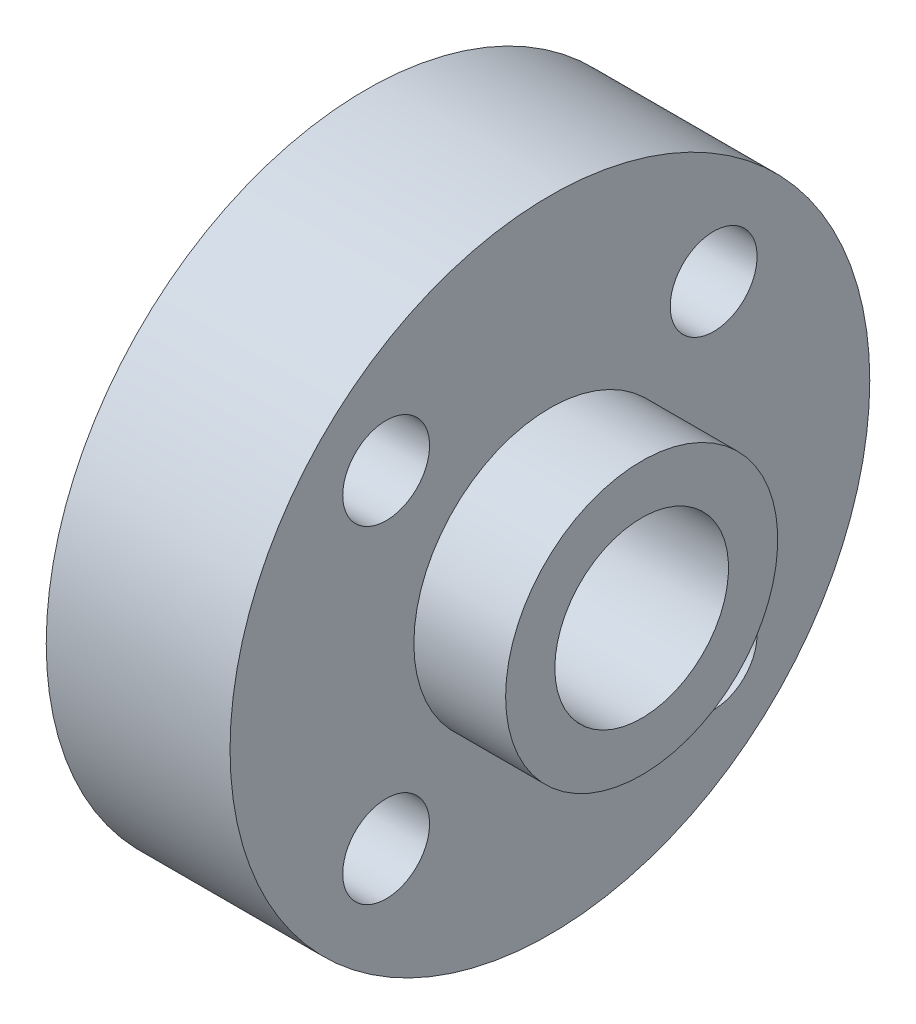
from build123d import *

# Parameters (mm, degrees)
ESQUISSE2_R                  = 3
ENL_V_MAT_EXTRU_1_DEPTH      = 21.136906416
ESQUISSE3_R                  = 1.5
ENL_V_MAT_EXTRU_2_DEPTH      = 10
R_P_TITION_CIRCULAIRE1_COUNT = 4
ESQUISSE5_R                  = 2.5
ENL_V_MAT_EXTRU_3_DEPTH      = 44.130678974


with BuildPart() as part:
    # Esquisse1 → Révolution1 (revolve)
    with BuildSketch(Plane(origin=(0, 0, 0), x_dir=(1, 0, 0), z_dir=(0, 1, 0))):
        Polygon((-40.200130208, 0), (-40.200130208, 4.7), (-37.020130208, 4.7), (-37.020130208, 11.05), (-30.670130208, 11.05), (-30.670130208, 4.7), (-27.500130208, 4.7), (-27.500130208, 0), align=None)
    revolve(axis=Axis((-53.297005208, 0, 0), (1, 0, 0)))

    # Esquisse2 → Enlèv. mat.-Extru.1 (cut, through all)
    with BuildSketch(Plane.ZY.offset(40.200130208)):
        Circle(ESQUISSE2_R)
    extrude(amount=-ENL_V_MAT_EXTRU_1_DEPTH, mode=Mode.SUBTRACT)

    # Esquisse3 → Enlèv. mat.-Extru.2 (cut)
    with BuildSketch(Plane.ZY.offset(37.020130208)):
        with Locations((-5.656854249, 5.656854249)):
            Circle(ESQUISSE3_R)
    enl_v_mat_extru_2 = extrude(amount=-ENL_V_MAT_EXTRU_2_DEPTH, mode=Mode.SUBTRACT)

    # Répétition circulaire1: Enlèv. mat.-Extru.2 ×4 about axis
    r_p_tition_circulaire1_axis = Axis((-40.200130208, 0, 0), (-1, 0, 0))
    for i in range(1, R_P_TITION_CIRCULAIRE1_COUNT):
        add(enl_v_mat_extru_2.rotate(r_p_tition_circulaire1_axis, i * 360 / R_P_TITION_CIRCULAIRE1_COUNT), mode=Mode.SUBTRACT)

    # Esquisse5 → Enlèv. mat.-Extru.3 (cut, through all)
    with BuildSketch(Plane.XY):
        with Locations((-33.845130208, 0)):
            Circle(ESQUISSE5_R)
    extrude(amount=-ENL_V_MAT_EXTRU_3_DEPTH, mode=Mode.SUBTRACT)


solid = part.part
